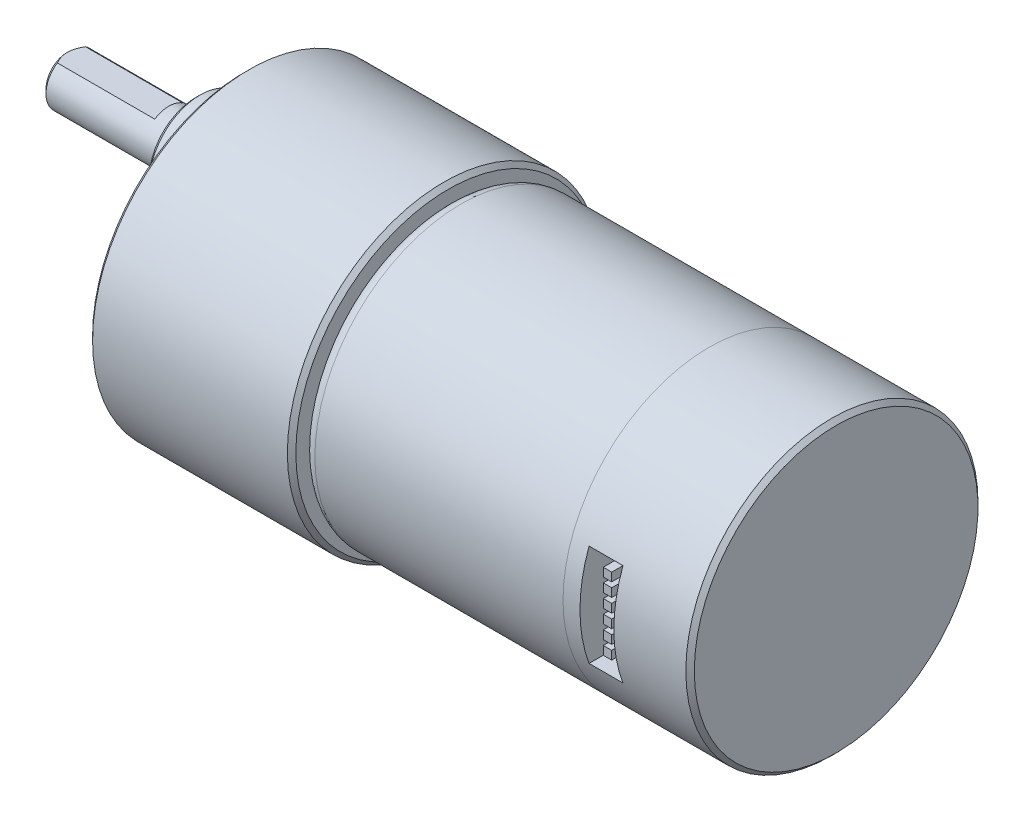
from build123d import *

# Parameters (mm, degrees)
SKETCH3_R                  = 6
BOSS_EXTRUDE1_DEPTH        = 5.8
SKETCH4_R                  = 3
BOSS_EXTRUDE2_DEPTH        = 15.2
SKETCH5_W                  = 3.31662479
SKETCH5_H                  = 2.173071946
CUT_EXTRUDE1_DEPTH         = 12
CHAMFER1_SIZE              = 0.5
CUT_EXTRUDE2_DEPTH         = 1
M3_TAPPED_HOLE1_AT_2_COUNT = 2
M3_TAPPED_HOLE1_AT_2_PITCH = 26.846787517
M3_TAPPED_HOLE1_AT_3_COUNT = 2
M3_TAPPED_HOLE1_AT_3_PITCH = 26.846787517
CIRPATTERN1_COUNT          = 2
SKETCH10_W                 = 4
SKETCH10_H                 = 12
CUT_EXTRUDE3_DEPTH         = 28
SKETCH11_W                 = 1
SKETCH11_H                 = 1
BOSS_EXTRUDE3_DEPTH        = 4
LPATTERN1_COUNT            = 6
LPATTERN1_PITCH            = 1.6


with BuildPart() as part:
    # Sketch1 → Revolve1 (revolve)
    with BuildSketch(Plane(origin=(0, 0, 0), x_dir=(1, 0, 0), z_dir=(0, 1, 0)), mode=Mode.PRIVATE) as revolve1_sk:
        with BuildLine():
            Line((0, 0), (69.8, 0))
            Line((69.8, 0), (69.8, 17.25))
            Line((69.8, 17.25), (25.5, 17.25))
            ThreePointArc((25.5, 17.25), (24.439339828, 16.810660172), (24, 15.75))
            Line((24, 15.75), (24, 18.5))
            Line((24, 18.5), (0, 18.5))
            Line((0, 18.5), (0, 0))
        make_face()
    revolve(revolve1_sk.sketch.rotate(Axis((0, 0, 0), (1, 0, 0)), 180), axis=Axis((0, 0, 0), (1, 0, 0)))

    # Sketch3 → Boss-Extrude1 (add)
    with BuildSketch(Plane.ZY):
        with Locations(Location((0, 7, 0), (0, 0, 180))):
            Circle(SKETCH3_R)
    extrude(amount=BOSS_EXTRUDE1_DEPTH)

    # Sketch4 → Boss-Extrude2 (add)
    with BuildSketch(Plane.ZY.offset(5.8)):
        with Locations(Location((0, 7, 0), (0, 0, 180))):
            Circle(SKETCH4_R)
    extrude(amount=BOSS_EXTRUDE2_DEPTH)

    # Sketch5 → Cut-Extrude1 (cut)
    with BuildSketch(Plane.ZY.offset(21)):
        with Locations((0, 10.586535973)):
            Rectangle(SKETCH5_W, SKETCH5_H)
    extrude(amount=-CUT_EXTRUDE1_DEPTH, mode=Mode.SUBTRACT)

    # Chamfer1
    chamfer1_edges = [part.edges().sort_by_distance(p)[0] for p in [
        (-5.8, 7, 6),
        (-21, 4.356617963, 1.418637165),
        (69.8, 0, -17.25),
        (24, 0, -18.5),
        (0, 0, -18.5),
    ]]
    chamfer(chamfer1_edges, length=CHAMFER1_SIZE - 0.0001)  # a hair under: the kernel refuses the full size

    # Sketch6 → Cut-Extrude2 (cut)
    with BuildSketch(Plane.ZY):
        with BuildLine():
            ThreePointArc((-8.802520946, 8.875), (0, -12.5), (8.802520946, 8.875))
            ThreePointArc((8.802520946, 8.875), (0, -2), (-8.802520946, 8.875))
        make_face()
    extrude(amount=-CUT_EXTRUDE2_DEPTH, mode=Mode.SUBTRACT)

    # Sketch8 → M3 Tapped Hole1 (revolve, cut)
    with BuildSketch(Plane(origin=(0, -13.423393759, -7.75), x_dir=(0, 0, 1), z_dir=(0, 1, 0))):
        Polygon((0, 0), (0, 4.751075774), (1.25, 4), (1.25, 0), align=None)
    m3_tapped_hole1 = revolve(axis=Axis((-6.35, -13.423393759, -7.75), (1, 0, 0)), mode=Mode.SUBTRACT)

    # M3 Tapped Hole1 at 2: M3 Tapped Hole1 ×2
    with Locations(*[(0, i * M3_TAPPED_HOLE1_AT_2_PITCH, 0) for i in range(1, M3_TAPPED_HOLE1_AT_2_COUNT)]):
        add(m3_tapped_hole1, mode=Mode.SUBTRACT)

    # M3 Tapped Hole1 at 3: M3 Tapped Hole1 ×2
    with Locations(*[Vector(0, 0.4999999999999991, 0.8660254037844392) * (i * M3_TAPPED_HOLE1_AT_3_PITCH) for i in range(1, M3_TAPPED_HOLE1_AT_3_COUNT)]):
        add(m3_tapped_hole1, mode=Mode.SUBTRACT)

    # CirPattern1: M3 Tapped Hole1 ×2 about axis
    cirpattern1_axis = Axis((0, 0, 0), (1, 0, 0))
    for i in range(1, CIRPATTERN1_COUNT):
        add(m3_tapped_hole1.rotate(cirpattern1_axis, i * 360 / CIRPATTERN1_COUNT), mode=Mode.SUBTRACT)

    # CirPattern1 copy 1 sketch → CirPattern1 copy 1 (revolve, cut)
    with BuildSketch(Plane(origin=(0, -13.423393759, 7.75), x_dir=(0, 0, -1), z_dir=(0, -1, 0))):
        Polygon((0, 0), (0, 4.751075774), (1.25, 4), (1.25, 0), align=None)
    revolve(axis=Axis((-6.35, -13.423393759, 7.75), (1, 0, 0)), mode=Mode.SUBTRACT)

    # CirPattern1 copy 2 sketch → CirPattern1 copy 2 (revolve, cut)
    with BuildSketch(Plane(origin=(0, 0, -15.5), x_dir=(0, 0, -1), z_dir=(0, -1, 0))):
        Polygon((0, 0), (0, 4.751075774), (1.25, 4), (1.25, 0), align=None)
    revolve(axis=Axis((-6.35, 0, -15.5), (1, 0, 0)), mode=Mode.SUBTRACT)

    # Sketch10 → Cut-Extrude3 (cut)
    with BuildSketch(Plane.XY.offset(40)):
        with Locations((58.8, 0)):
            Rectangle(SKETCH10_W, SKETCH10_H)
    extrude(amount=-CUT_EXTRUDE3_DEPTH, mode=Mode.SUBTRACT)

    # Sketch11 → Boss-Extrude3 (add)
    with BuildSketch(Plane.XY.offset(12)):
        with Locations((58.8, -4)):
            Rectangle(SKETCH11_W, SKETCH11_H)
    boss_extrude3 = extrude(amount=BOSS_EXTRUDE3_DEPTH)

    # LPattern1: Boss-Extrude3 ×6
    with Locations(*[(0, i * LPATTERN1_PITCH, 0) for i in range(1, LPATTERN1_COUNT)]):
        add(boss_extrude3)


solid = part.part
